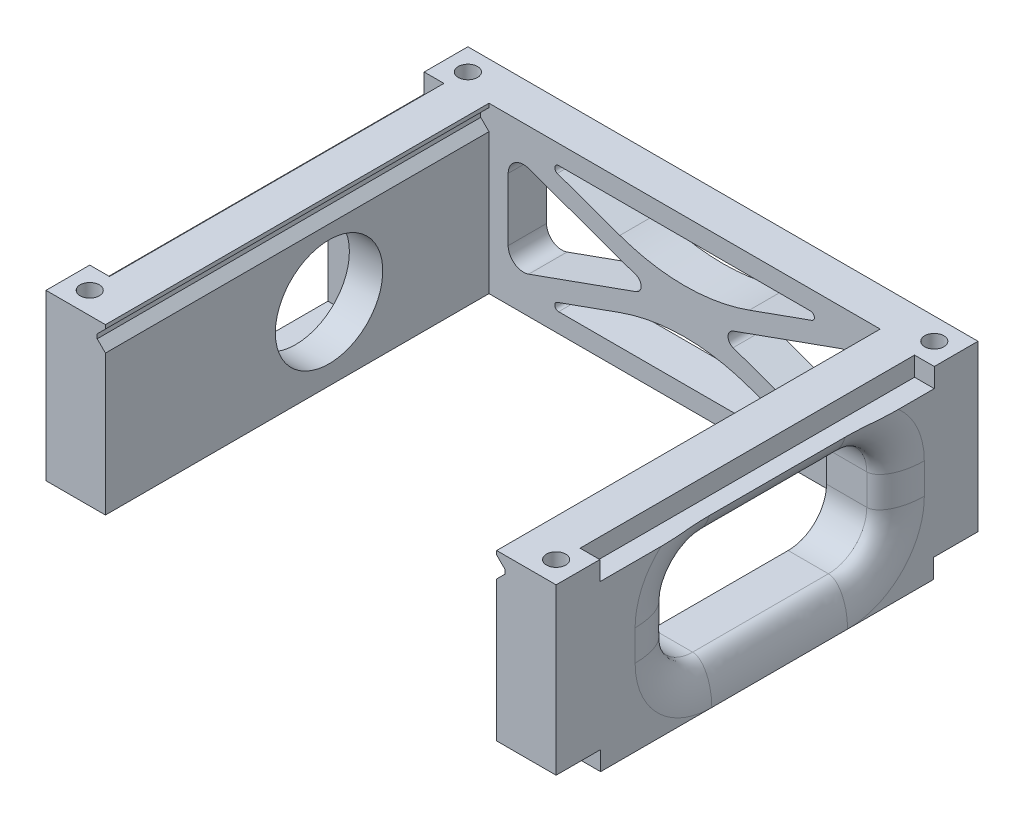
from build123d import *

# Parameters (mm, degrees)
BOSS_EXTRUDE1_DEPTH   = 100
BOSS_EXTRUDE1_2_DEPTH = 100
SKETCH2_W             = 133
SKETCH2_H             = 43
BOSS_EXTRUDE2_DEPTH   = 10
SKETCH7_R             = 2.5
CUT_EXTRUDE5_DEPTH    = 164.111158417
CUT_EXTRUDE6_START    = -43
SKETCH9_W             = 5.15
SKETCH9_H             = 87.2
CUT_EXTRUDE6_DEPTH    = 5
SKETCH9_2_W           = 5
SKETCH9_2_H           = 86.8
BOSS_EXTRUDE3_DEPTH   = 5
CUT_EXTRUDE7_DEPTH    = 162.725106276
FILLET9_R             = 2
FILLET10_R            = 50
FILLET11_R            = 4
FILLET12_R            = 1
CUT_EXTRUDE11_DEPTH   = 100
CUT_EXTRUDE14_START   = -6.8
SKETCH21_W            = 30.4
SKETCH21_H            = 30.4
CUT_EXTRUDE14_DEPTH   = 6.8
CUT_EXTRUDE15_START   = -133
CUT_EXTRUDE15_DEPTH   = 15.5
FILLET20_SIZE         = 10
FILLET20_SIZE_2       = 5
CUT_EXTRUDE16_REACH   = 178.601
SKETCH21_4_R          = 14
CUT_EXTRUDE17_START   = -13.5
SKETCH21_5_R          = 2
CUT_EXTRUDE17_DEPTH   = 6.7


with BuildPart() as part:
    # Sketch1 → Boss-Extrude1 (new body)
    with BuildSketch(Plane.XY):
        Polygon((-97, 10.6), (-112.5, 10.6), (-112.5, -32.4), (-97, -32.4), (-97, -0.6), align=None)
    extrude(amount=-BOSS_EXTRUDE1_DEPTH)



with BuildPart() as body_2:
    # Sketch1 → Boss-Extrude1 2 (new body)
    with BuildSketch(Plane.XY):
        Polygon((5, 10.6), (5, -0.6), (5, -32.4), (20.5, -32.4), (20.5, 10.6), align=None)
    extrude(amount=-BOSS_EXTRUDE1_2_DEPTH)


with BuildPart() as part_1:
    add(part.part)

    add(body_2.part)  # Boss-Extrude2 merges body 2
    # Sketch2 → Boss-Extrude2 (add)
    with BuildSketch(Plane(origin=(0, 0, -100), x_dir=(-1, 0, 0), z_dir=(0, 0, -1))):
        with Locations((46, -10.9)):
            Rectangle(SKETCH2_W, SKETCH2_H)
    extrude(amount=BOSS_EXTRUDE2_DEPTH)

    # Sketch7 → Cut-Extrude5 (cut, through all)
    with BuildSketch(Plane.XZ.offset(32.4)):
        with Locations(Location((-106.8, -5.7, 0), (0, 0, 270))):
            Circle(SKETCH7_R)
        with Locations(Location((-106.8, -104.3, 0), (0, 0, 270))):
            Circle(SKETCH7_R)
        with Locations(Location((14.8, -5.7, 0), (0, 0, 270))):
            Circle(SKETCH7_R)
        with Locations(Location((14.8, -104.3, 0), (0, 0, 270))):
            Circle(SKETCH7_R)
    extrude(amount=-CUT_EXTRUDE5_DEPTH, mode=Mode.SUBTRACT)

    # Sketch9 → Cut-Extrude6 (cut)
    with BuildSketch(Plane.XZ.offset(32.4).offset(CUT_EXTRUDE6_START)):
        with Locations((-109.925, -55)):
            Rectangle(SKETCH9_W, SKETCH9_H)
        with Locations((17.925, -55)):
            Rectangle(SKETCH9_W, SKETCH9_H)
    extrude(amount=CUT_EXTRUDE6_DEPTH, mode=Mode.SUBTRACT)

    # Sketch9<2> → Boss-Extrude3 (add)
    with BuildSketch(Plane.XZ.offset(32.4)):
        with Locations((18, -55)):
            Rectangle(SKETCH9_2_W, SKETCH9_2_H)
        with Locations((-110, -55)):
            Rectangle(SKETCH9_2_W, SKETCH9_2_H)
    extrude(amount=BOSS_EXTRUDE3_DEPTH)

    # Sketch10 → Cut-Extrude7 (cut, through all)
    with BuildSketch(Plane(origin=(0, 0, -110), x_dir=(-1, 0, 0), z_dir=(0, 0, -1))):
        Polygon((53.404503754, -10.9), (92, -24.744036697), (92, 2.944036697), align=None)
        Polygon((7.404503754, -27.4), (84.595496246, -27.4), (46, -13.555963303), align=None)
        Polygon((7.404503754, 5.6), (46, -8.244036697), (84.595496246, 5.6), align=None)
        Polygon((0, -24.744036697), (38.595496246, -10.9), (0, 2.944036697), align=None)
    extrude(amount=-CUT_EXTRUDE7_DEPTH, mode=Mode.SUBTRACT)

    # Fillet9
    fillet9_edges = [part_1.edges().sort_by_distance(p)[0] for p in [
        (-38.595496246, -10.9, -105),
        (-53.404503754, -10.9, -105),
    ]]
    fillet(fillet9_edges, radius=FILLET9_R)

    # Fillet10
    fillet10_edges = [part_1.edges().sort_by_distance(p)[0] for p in [
        (-46, -13.555963303, -105),
        (-46, -8.244036697, -105),
    ]]
    fillet(fillet10_edges, radius=FILLET10_R)

    # Fillet11
    fillet11_edges = [part_1.edges().sort_by_distance(p)[0] for p in [
        (0, -24.744036697, -105),
        (0, 2.944036697, -105),
        (-92, 2.944036697, -105),
        (-92, -24.744036697, -105),
    ]]
    fillet(fillet11_edges, radius=FILLET11_R)

    # Fillet12
    fillet12_edges = [part_1.edges().sort_by_distance(p)[0] for p in [
        (-84.595496246, -27.4, -105),
        (-7.404503754, -27.4, -105),
        (-84.595496246, 5.6, -105),
        (-7.404503754, 5.6, -105),
    ]]
    fillet(fillet12_edges, radius=FILLET12_R)

    # Sketch13 → Cut-Extrude11 (cut)
    with BuildSketch(Plane.XY):
        Polygon((-97, 4.175735931), (-99.15, 6.325735931), (-99.15, 7.45), (-97, 9.6), align=None)
        Polygon((7.15, 7.45), (5, 9.6), (5, 4.175735931), (7.15, 6.325735931), align=None)
    extrude(amount=-CUT_EXTRUDE11_DEPTH, mode=Mode.SUBTRACT)

    # Sketch21 → Cut-Extrude14 (cut)
    with BuildSketch(Plane.ZY.offset(112.5).offset(CUT_EXTRUDE14_START)):
        with Locations((-58.299759675, -13.4)):
            Rectangle(SKETCH21_W, SKETCH21_H)
    extrude(amount=CUT_EXTRUDE14_DEPTH, mode=Mode.SUBTRACT)

    # Sketch17<5> → Cut-Extrude15 (cut)
    with BuildSketch(Plane.ZY.offset(112.5).offset(CUT_EXTRUDE15_START)):
        with BuildLine():
            ThreePointArc((-75.999759675, -27.4), (-83.070827486, -24.471067812), (-85.999759675, -17.4))
            Line((-85.999759675, -17.4), (-85.999759675, -9.4))
            ThreePointArc((-85.999759675, -9.4), (-83.070827486, -2.328932188), (-75.999759675, 0.6))
            Line((-75.999759675, 0.6), (-40.599759675, 0.6))
            ThreePointArc((-40.599759675, 0.6), (-33.528691863, -2.328932188), (-30.599759675, -9.4))
            Line((-30.599759675, -9.4), (-30.599759675, -17.4))
            ThreePointArc((-30.599759675, -17.4), (-33.528691863, -24.471067812), (-40.599759675, -27.4))
            Line((-40.599759675, -27.4), (-75.999759675, -27.4))
        make_face()
    extrude(amount=CUT_EXTRUDE15_DEPTH, mode=Mode.SUBTRACT)

    # Fillet20
    # an asymmetric fillet: 10, 5 mm, written as the material it takes off along each edge
    with BuildSketch(Plane(origin=(20.5, -9.4, -30.599759675), x_dir=(0, 0, 1), z_dir=(0, -1, 0)), Plane(origin=(20.5, -17.4, -85.999759675), x_dir=(0, 0, -1), z_dir=(0, 1, 0))) as fillet20_piece_1:
        with BuildLine():
            Bezier((FILLET20_SIZE, 0), (0, 0), (0, FILLET20_SIZE_2), weights=[1, 0.707106781, 1])
            Line((0, FILLET20_SIZE_2), (0, 0))
            Line((0, 0), (FILLET20_SIZE, 0))
        make_face()
    extrude(amount=8, mode=Mode.SUBTRACT)
    with BuildSketch(Plane(origin=(20.5, -17.4, -40.599759675), x_dir=(0, 0, 1), z_dir=(0, 1, 0))) as fillet20_piece_2:
        with BuildLine():
            Bezier((10 + FILLET20_SIZE, 0), (10, 0), (10, -FILLET20_SIZE_2), weights=[1, 0.707106781, 1])
            Line((10, -FILLET20_SIZE_2), (10, 0))
            Line((10, 0), (10 + FILLET20_SIZE, 0))
        make_face()
    revolve(axis=Axis((20.5, -17.4, -40.599759675), (1, 0, 0)), revolution_arc=90, mode=Mode.SUBTRACT)
    with BuildSketch(Plane(origin=(20.5, -9.4, -40.599759675), x_dir=(0, 1, 0), z_dir=(0, 0, -1))) as fillet20_piece_3:
        with BuildLine():
            Bezier((10 + FILLET20_SIZE, 0), (10, 0), (10, -FILLET20_SIZE_2), weights=[1, 0.707106781, 1])
            Line((10, -FILLET20_SIZE_2), (10, 0))
            Line((10, 0), (10 + FILLET20_SIZE, 0))
        make_face()
    revolve(axis=Axis((20.5, -9.4, -40.599759675), (1, 0, 0)), revolution_arc=90, mode=Mode.SUBTRACT)
    with BuildSketch(Plane(origin=(20.5, -27.4, -40.599759675), x_dir=(0, -1, 0), z_dir=(0, 0, -1)), Plane(origin=(20.5, 0.6, -75.999759675), x_dir=(0, 1, 0), z_dir=(0, 0, 1))) as fillet20_piece_4:
        with BuildLine():
            Bezier((FILLET20_SIZE, 0), (0, 0), (0, FILLET20_SIZE_2), weights=[1, 0.707106781, 1])
            Line((0, FILLET20_SIZE_2), (0, 0))
            Line((0, 0), (FILLET20_SIZE, 0))
        make_face()
    extrude(amount=35.399999999, mode=Mode.SUBTRACT)
    with BuildSketch(Plane(origin=(20.5, -17.4, -75.999759675), x_dir=(0, -1, 0), z_dir=(0, 0, 1))) as fillet20_piece_5:
        with BuildLine():
            Bezier((10 + FILLET20_SIZE, 0), (10, 0), (10, -FILLET20_SIZE_2), weights=[1, 0.707106781, 1])
            Line((10, -FILLET20_SIZE_2), (10, 0))
            Line((10, 0), (10 + FILLET20_SIZE, 0))
        make_face()
    revolve(axis=Axis((20.5, -17.4, -75.999759675), (1, 0, 0)), revolution_arc=90, mode=Mode.SUBTRACT)
    with BuildSketch(Plane(origin=(20.5, -9.4, -75.999759675), x_dir=(0, 0, -1), z_dir=(0, -1, 0))) as fillet20_piece_6:
        with BuildLine():
            Bezier((10 + FILLET20_SIZE, 0), (10, 0), (10, -FILLET20_SIZE_2), weights=[1, 0.707106781, 1])
            Line((10, -FILLET20_SIZE_2), (10, 0))
            Line((10, 0), (10 + FILLET20_SIZE, 0))
        make_face()
    revolve(axis=Axis((20.5, -9.4, -75.999759675), (1, 0, 0)), revolution_arc=90, mode=Mode.SUBTRACT)

    # Sketch21<4> → Cut-Extrude16 (cut, up to next)
    with BuildSketch(Plane.ZY.offset(112.5), mode=Mode.PRIVATE) as cut_extrude16_sk1:
        with Locations((-58.299759675, -13.4)):
            Circle(SKETCH21_4_R)
    cut_extrude16_tool1 = extrude(cut_extrude16_sk1.sketch, amount=-CUT_EXTRUDE16_REACH, mode=Mode.PRIVATE) & part_1.part
    add(cut_extrude16_tool1.solids().sort_by_distance((-112.5, -13.4, -58.29976))[0], mode=Mode.SUBTRACT)

    # Sketch21<5> → Cut-Extrude17 (cut)
    with BuildSketch(Plane.ZY.offset(112.5).offset(CUT_EXTRUDE17_START)):
        with Locations(Location((-70.299759675, -1.4, 0), (0, 0, 180))):
            Circle(SKETCH21_5_R)
        with Locations(Location((-46.299759675, -1.4, 0), (0, 0, 180))):
            Circle(SKETCH21_5_R)
        with Locations(Location((-46.299759675, -25.4, 0), (0, 0, 180))):
            Circle(SKETCH21_5_R)
        with Locations(Location((-70.299759675, -25.4, 0), (0, 0, 180))):
            Circle(SKETCH21_5_R)
    extrude(amount=CUT_EXTRUDE17_DEPTH, mode=Mode.SUBTRACT)


solid = part_1.part
